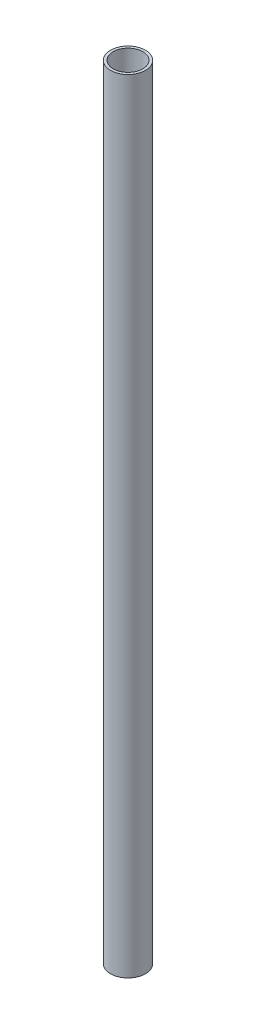
from build123d import *

# Parameters (mm, degrees)
SKETCH1_R           = 3.35
SKETCH1_R_2         = 2.85
BOSS_EXTRUDE1_DEPTH = 150


with BuildPart() as part:
    # Sketch1 → Boss-Extrude1 (new body)
    with BuildSketch(Plane(origin=(0, 0, 0), x_dir=(1, 0, 0), z_dir=(0, 1, 0))):
        Circle(SKETCH1_R)
        Circle(SKETCH1_R_2, mode=Mode.SUBTRACT)
    extrude(amount=BOSS_EXTRUDE1_DEPTH)


solid = part.part
